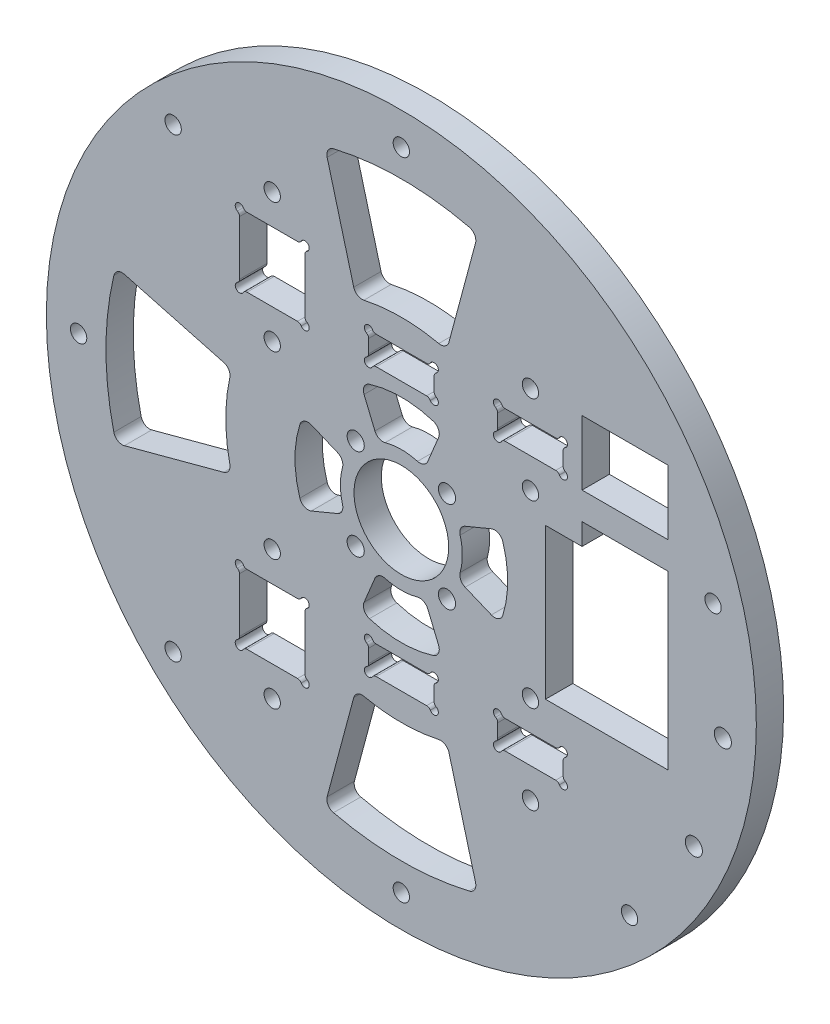
from build123d import *

# Parameters (mm, degrees)
SKETCH1_R                = 82.5
SKETCH1_R_2              = 1.89865
SKETCH1_R_3              = 1.9939
SKETCH1_R_4              = 11
BOSS_EXTRUDE1_DEPTH      = 6.35
SKETCH5_W                = 15.2
SKETCH5_H                = 16.075
CUT_EXTRUDE4_DEPTH       = 117.845293016
SKETCH6_R                = 1
CUT_EXTRUDE5_DEPTH       = 117.845293016
FILLET1_R                = 1
SKETCH10_W               = 53.521327686
SKETCH10_H               = 38.330479901
SKETCH10_W_2             = 53.671144578
SKETCH10_H_2             = 39.035756806
BOSS_EXTRUDE2_DEPTH      = 6.35
SKETCH11_W               = 15.2
SKETCH11_H               = 6.55
CUT_EXTRUDE8_DEPTH       = 117.845293016
SKETCH13_R               = 1
CUT_EXTRUDE9_DEPTH       = 117.845293016
FILLET2_R                = 1
LPATTERN3_COUNT          = 2
LPATTERN3_PITCH          = 30
FILLET2_OF_LPATTERN3_R   = 1
MIRROR3_DEPTH            = 6.35
SKETCH14_W               = 20
SKETCH14_H               = 15
CUT_EXTRUDE10_DEPTH      = 117.845293016
SKETCH15_R               = 1.89865
CUT_EXTRUDE12_DEPTH      = 117.845293016
CUT_EXTRUDE13_DEPTH      = 117.845293016
FILLET3_R                = 2
CIRPATTERN1_COUNT        = 4
FILLET3_OF_CIRPATTERN1_R = 2
CUT_EXTRUDE14_DEPTH      = 117.845293016
FILLET4_R                = 2
CIRPATTERN2_COUNT        = 4
FILLET4_OF_CIRPATTERN2_R = 2


# Read off the part's stored shape, not the designer's step: Mirror3
with BuildPart() as part:
    # Sketch1 → Boss-Extrude1 (new body)
    with BuildSketch(Plane.XY):
        Circle(SKETCH1_R)
        with Locations((72.444436972, 19.411428383)):
            Circle(SKETCH1_R_2, mode=Mode.SUBTRACT)
        with Locations((74.714602357, -6.536680706)):
            Circle(SKETCH1_R_3, mode=Mode.SUBTRACT)
        Circle(SKETCH1_R_4, mode=Mode.SUBTRACT)
        with Locations((67.973084028, -31.696369631)):
            Circle(SKETCH1_R_3, mode=Mode.SUBTRACT)
        with Locations((10.606601718, -10.606601718)):
            Circle(SKETCH1_R_3, mode=Mode.SUBTRACT)
        with Locations((0, -75)):
            Circle(SKETCH1_R_2, mode=Mode.SUBTRACT)
        with Locations((-10.606601718, -10.606601718)):
            Circle(SKETCH1_R_3, mode=Mode.SUBTRACT)
        with Locations((-10.606601718, 10.606601718)):
            Circle(SKETCH1_R_3, mode=Mode.SUBTRACT)
        with Locations((10.606601718, 10.606601718)):
            Circle(SKETCH1_R_3, mode=Mode.SUBTRACT)
        with Locations((-53.033008589, -53.033008589)):
            Circle(SKETCH1_R_2, mode=Mode.SUBTRACT)
        with Locations((-75, 0)):
            Circle(SKETCH1_R_2, mode=Mode.SUBTRACT)
        with Locations((-53.033008589, 53.033008589)):
            Circle(SKETCH1_R_2, mode=Mode.SUBTRACT)
        with Locations((0, 75)):
            Circle(SKETCH1_R_2, mode=Mode.SUBTRACT)
        with Locations((53.033008589, -53.033008589)):
            Circle(SKETCH1_R_2, mode=Mode.SUBTRACT)
    extrude(amount=BOSS_EXTRUDE1_DEPTH)

    # Sketch5 → Cut-Extrude4 (cut, through all)
    with BuildSketch(Plane.XY.offset(6.35)):
        with Locations((-30, -35.9375)):
            Rectangle(SKETCH5_W, SKETCH5_H)
        with Locations((-30, 35.9375)):
            Rectangle(SKETCH5_W, SKETCH5_H)
        with Locations((30, 35.9375)):
            Rectangle(SKETCH5_W, SKETCH5_H)
        with Locations((0, -35.9375)):
            Rectangle(SKETCH5_W, SKETCH5_H)
        with Locations((30, -35.9375)):
            Rectangle(SKETCH5_W, SKETCH5_H)
        with Locations((0, 35.9375)):
            Rectangle(SKETCH5_W, SKETCH5_H)
    extrude(amount=-CUT_EXTRUDE4_DEPTH, mode=Mode.SUBTRACT)

    # Sketch6 → Cut-Extrude5 (cut, through all)
    with BuildSketch(Plane.XY.offset(6.35)):
        with Locations((-37.6, 43.975)):
            Circle(SKETCH6_R)
        with Locations((-22.4, 43.975)):
            Circle(SKETCH6_R)
        with Locations((-37.6, 27.9)):
            Circle(SKETCH6_R)
        with Locations((-22.4, 27.9)):
            Circle(SKETCH6_R)
        with Locations((-7.6, 43.975)):
            Circle(SKETCH6_R)
        with Locations((7.6, 43.975)):
            Circle(SKETCH6_R)
        with Locations((-7.6, 27.9)):
            Circle(SKETCH6_R)
        with Locations((7.6, 27.9)):
            Circle(SKETCH6_R)
        with Locations((22.4, 43.975)):
            Circle(SKETCH6_R)
        with Locations((37.6, 43.975)):
            Circle(SKETCH6_R)
        with Locations((22.4, 27.9)):
            Circle(SKETCH6_R)
        with Locations((37.6, 27.9)):
            Circle(SKETCH6_R)
        with Locations((-37.6, -27.9)):
            Circle(SKETCH6_R)
        with Locations((-22.4, -27.9)):
            Circle(SKETCH6_R)
        with Locations((-37.6, -43.975)):
            Circle(SKETCH6_R)
        with Locations((-22.4, -43.975)):
            Circle(SKETCH6_R)
        with Locations((-7.6, -27.9)):
            Circle(SKETCH6_R)
        with Locations((7.6, -27.9)):
            Circle(SKETCH6_R)
        with Locations((-7.6, -43.975)):
            Circle(SKETCH6_R)
        with Locations((7.6, -43.975)):
            Circle(SKETCH6_R)
        with Locations((22.4, -27.9)):
            Circle(SKETCH6_R)
        with Locations((37.6, -27.9)):
            Circle(SKETCH6_R)
        with Locations((22.4, -43.975)):
            Circle(SKETCH6_R)
        with Locations((37.6, -43.975)):
            Circle(SKETCH6_R)
    extrude(amount=-CUT_EXTRUDE5_DEPTH, mode=Mode.SUBTRACT)

    # Fillet1
    fillet1_edges = [part.edges().sort_by_distance(p)[0] for p in [
        (-37.6, 42.975, 3.175),
        (-36.6, 43.975, 3.175),
        (-22.4, 42.975, 3.175),
        (-23.4, 43.975, 3.175),
        (-37.6, 28.9, 3.175),
        (-36.6, 27.9, 3.175),
        (-23.4, 27.9, 3.175),
        (-22.4, 28.9, 3.175),
        (-7.6, 42.975, 3.175),
        (-6.6, 43.975, 3.175),
        (7.6, 42.975, 3.175),
        (6.6, 43.975, 3.175),
        (-7.6, 28.9, 3.175),
        (-6.6, 27.9, 3.175),
        (6.6, 27.9, 3.175),
        (7.6, 28.9, 3.175),
        (22.4, 42.975, 3.175),
        (23.4, 43.975, 3.175),
        (37.6, 42.975, 3.175),
        (36.6, 43.975, 3.175),
        (22.4, 28.9, 3.175),
        (23.4, 27.9, 3.175),
        (36.6, 27.9, 3.175),
        (37.6, 28.9, 3.175),
        (-36.6, -27.9, 3.175),
        (-37.6, -28.9, 3.175),
        (-22.4, -28.9, 3.175),
        (-23.4, -27.9, 3.175),
        (-36.6, -43.975, 3.175),
        (-37.6, -42.975, 3.175),
        (-23.4, -43.975, 3.175),
        (-22.4, -42.975, 3.175),
        (-6.6, -27.9, 3.175),
        (-7.6, -28.9, 3.175),
        (7.6, -28.9, 3.175),
        (6.6, -27.9, 3.175),
        (-6.6, -43.975, 3.175),
        (-7.6, -42.975, 3.175),
        (6.6, -43.975, 3.175),
        (7.6, -42.975, 3.175),
        (23.4, -27.9, 3.175),
        (22.4, -28.9, 3.175),
        (37.6, -28.9, 3.175),
        (36.6, -27.9, 3.175),
        (23.4, -43.975, 3.175),
        (22.4, -42.975, 3.175),
        (36.6, -43.975, 3.175),
        (37.6, -42.975, 3.175),
    ]]
    fillet(fillet1_edges, radius=FILLET1_R)

    # Sketch10 → Boss-Extrude2 (add, through all)
    with BuildSketch(Plane(origin=(0, 0, 0), x_dir=(-1, 0, 0), z_dir=(0, 0, -1))):
        with Locations((-14.795735284, 41.600791801)):
            Rectangle(SKETCH10_W, SKETCH10_H)
        with Locations((-14.87064373, -42.15054159)):
            Rectangle(SKETCH10_W_2, SKETCH10_H_2)
    extrude(amount=-BOSS_EXTRUDE2_DEPTH)

    # Sketch11 → Cut-Extrude8 (cut, through all)
    with BuildSketch(Plane(origin=(0, 0, 0), x_dir=(-1, 0, 0), z_dir=(0, 0, -1))):
        with Locations((0, 31.175)):
            Rectangle(SKETCH11_W, SKETCH11_H)
    cut_extrude8 = extrude(amount=-CUT_EXTRUDE8_DEPTH, mode=Mode.SUBTRACT)

    # Sketch13 → Cut-Extrude9 (cut, through all)
    with BuildSketch(Plane(origin=(0, 0, 0), x_dir=(-1, 0, 0), z_dir=(0, 0, -1))):
        with Locations((-7.6, 34.45)):
            Circle(SKETCH13_R)
        with Locations((-7.6, 27.9)):
            Circle(SKETCH13_R)
        with Locations((7.6, 27.9)):
            Circle(SKETCH13_R)
        with Locations((7.6, 34.45)):
            Circle(SKETCH13_R)
    cut_extrude9 = extrude(amount=-CUT_EXTRUDE9_DEPTH, mode=Mode.SUBTRACT)

    # Fillet2
    fillet2_edges = [part.edges().sort_by_distance(p)[0] for p in [
        (6.6, 34.45, 3.175),
        (7.6, 33.45, 3.175),
        (-6.6, 34.45, 3.175),
        (7.6, 28.9, 3.175),
        (-6.6, 27.9, 3.175),
        (6.6, 27.9, 3.175),
        (-7.6, 28.9, 3.175),
        (-7.6, 33.45, 3.175),
    ]]
    fillet(fillet2_edges, radius=FILLET2_R)

    # LPattern3: Cut-Extrude8, Cut-Extrude9 ×2
    with Locations(*[(i * LPATTERN3_PITCH, 0, 0) for i in range(1, LPATTERN3_COUNT)]):
        add(cut_extrude8, mode=Mode.SUBTRACT)
        add(cut_extrude9, mode=Mode.SUBTRACT)

    # Fillet2 of LPattern3
    fillet2_of_lpattern3_edges = [part.edges().sort_by_distance(p)[0] for p in [
        (36.6, 34.45, 3.175),
        (37.6, 33.45, 3.175),
        (23.4, 34.45, 3.175),
        (37.6, 28.9, 3.175),
        (23.4, 27.9, 3.175),
        (36.6, 27.9, 3.175),
        (22.4, 28.9, 3.175),
        (22.4, 33.45, 3.175),
    ]]
    fillet(fillet2_of_lpattern3_edges, radius=FILLET2_OF_LPATTERN3_R)

    # Mirror3 outline → Mirror3 (cut)
    with BuildSketch(Plane.XY):
        with BuildLine():
            Line((-5.867949192, -34.45), (5.867949192, -34.45))
            ThreePointArc((5.867949192, -34.45), (6.367949192, -34.583974596), (6.733974596, -34.95))
            ThreePointArc((6.733974596, -34.95), (8.307106781, -35.157106781), (8.1, -33.583974596))
            ThreePointArc((8.1, -33.583974596), (7.733974596, -33.217949192), (7.6, -32.717949192))
            Line((7.6, -32.717949192), (7.6, -29.632050808))
            ThreePointArc((7.6, -29.632050808), (7.733974596, -29.132050808), (8.1, -28.766025404))
            ThreePointArc((8.1, -28.766025404), (8.307106781, -27.192893219), (6.733974596, -27.4))
            ThreePointArc((6.733974596, -27.4), (6.367949192, -27.766025404), (5.867949192, -27.9))
            Line((5.867949192, -27.9), (-5.867949192, -27.9))
            ThreePointArc((-5.867949192, -27.9), (-6.367949192, -27.766025404), (-6.733974596, -27.4))
            ThreePointArc((-6.733974596, -27.4), (-8.307106781, -27.192893219), (-8.1, -28.766025404))
            ThreePointArc((-8.1, -28.766025404), (-7.733974596, -29.132050808), (-7.6, -29.632050808))
            Line((-7.6, -29.632050808), (-7.6, -32.717949192))
            ThreePointArc((-7.6, -32.717949192), (-7.733974596, -33.217949192), (-8.1, -33.583974596))
            ThreePointArc((-8.1, -33.583974596), (-8.307106781, -35.157106781), (-6.733974596, -34.95))
            ThreePointArc((-6.733974596, -34.95), (-6.367949192, -34.583974596), (-5.867949192, -34.45))
        make_face()
        with BuildLine():
            Line((24.132050808, -34.45), (35.867949192, -34.45))
            ThreePointArc((35.867949192, -34.45), (36.367949192, -34.583974596), (36.733974596, -34.95))
            ThreePointArc((36.733974596, -34.95), (38.307106781, -35.157106781), (38.1, -33.583974596))
            ThreePointArc((38.1, -33.583974596), (37.733974596, -33.217949192), (37.6, -32.717949192))
            Line((37.6, -32.717949192), (37.6, -29.632050808))
            ThreePointArc((37.6, -29.632050808), (37.733974596, -29.132050808), (38.1, -28.766025404))
            ThreePointArc((38.1, -28.766025404), (38.307106781, -27.192893219), (36.733974596, -27.4))
            ThreePointArc((36.733974596, -27.4), (36.367949192, -27.766025404), (35.867949192, -27.9))
            Line((35.867949192, -27.9), (24.132050808, -27.9))
            ThreePointArc((24.132050808, -27.9), (23.632050808, -27.766025404), (23.266025404, -27.4))
            ThreePointArc((23.266025404, -27.4), (21.692893219, -27.192893219), (21.9, -28.766025404))
            ThreePointArc((21.9, -28.766025404), (22.266025404, -29.132050808), (22.4, -29.632050808))
            Line((22.4, -29.632050808), (22.4, -32.717949192))
            ThreePointArc((22.4, -32.717949192), (22.266025404, -33.217949192), (21.9, -33.583974596))
            ThreePointArc((21.9, -33.583974596), (21.692893219, -35.157106781), (23.266025404, -34.95))
            ThreePointArc((23.266025404, -34.95), (23.632050808, -34.583974596), (24.132050808, -34.45))
        make_face()
    extrude(amount=MIRROR3_DEPTH, mode=Mode.SUBTRACT)

    # Sketch14 → Cut-Extrude10 (cut, through all)
    with BuildSketch(Plane.XY):
        Polygon((42, 20.65), (62, 20.65), (62, -19.35), (33.5, -19.35), (33.5, 15.65), (42, 15.65), align=None)
        with Locations((52, 34.5)):
            Rectangle(SKETCH14_W, SKETCH14_H)
    extrude(amount=CUT_EXTRUDE10_DEPTH, mode=Mode.SUBTRACT)

    # Sketch15 → Cut-Extrude12 (cut, through all)
    with BuildSketch(Plane.XY.offset(6.35)):
        with Locations((-30, 50.975)):
            Circle(SKETCH15_R)
        with Locations((-30, 20.9)):
            Circle(SKETCH15_R)
        with Locations((30, 41.45)):
            Circle(SKETCH15_R)
        with Locations((30, 20.9)):
            Circle(SKETCH15_R)
    cut_extrude12 = extrude(amount=-CUT_EXTRUDE12_DEPTH, mode=Mode.SUBTRACT)

    # Mirror4: Cut-Extrude12 across plane
    add(cut_extrude12.mirror(Plane.ZX), mode=Mode.SUBTRACT)

    # Sketch16 → Cut-Extrude13 (cut, through all)
    with BuildSketch(Plane.XY.offset(6.35)):
        with BuildLine():
            Line((-9.461847865, -22.842921441), (-5.424537654, -13.095992373))
            ThreePointArc((-5.424537654, -13.095992373), (0, -14.175), (5.424537654, -13.095992373))
            Line((5.424537654, -13.095992373), (9.461847865, -22.842921441))
            ThreePointArc((9.461847865, -22.842921441), (0, -24.725), (-9.461847865, -22.842921441))
        make_face()
    cut_extrude13 = extrude(amount=-CUT_EXTRUDE13_DEPTH, mode=Mode.SUBTRACT)

    # Fillet3
    fillet3_edges = [part.edges().sort_by_distance(p)[0] for p in [
        (-5.424537654, -13.095992373, 3.175),
        (5.424537654, -13.095992373, 3.175),
        (9.461847865, -22.842921441, 3.175),
        (-9.461847865, -22.842921441, 3.175),
    ]]
    fillet(fillet3_edges, radius=FILLET3_R)

    # CirPattern1: Cut-Extrude13 ×4 about axis
    cirpattern1_axis = Axis((0, 0, 0), (0, 0, 1))
    for i in range(1, CIRPATTERN1_COUNT):
        add(cut_extrude13.rotate(cirpattern1_axis, i * 360 / CIRPATTERN1_COUNT), mode=Mode.SUBTRACT)

    # Fillet3 of CirPattern1
    fillet3_of_cirpattern1_edges = [part.edges().sort_by_distance(p)[0] for p in [
        (13.095992373, -5.424537654, 3.175),
        (13.095992373, 5.424537654, 3.175),
        (22.842921441, 9.461847865, 3.175),
        (22.842921441, -9.461847865, 3.175),
        (5.424537654, 13.095992373, 3.175),
        (-5.424537654, 13.095992373, 3.175),
        (-9.461847865, 22.842921441, 3.175),
        (9.461847865, 22.842921441, 3.175),
        (-13.095992373, 5.424537654, 3.175),
        (-13.095992373, -5.424537654, 3.175),
        (-22.842921441, -9.461847865, 3.175),
        (-22.842921441, 9.461847865, 3.175),
    ]]
    fillet(fillet3_of_cirpattern1_edges, radius=FILLET3_OF_CIRPATTERN1_R)

    # Sketch17 → Cut-Extrude14 (cut, through all)
    with BuildSketch(Plane.XY.offset(6.35)):
        with BuildLine():
            Line((-17.767927446, -66.310807975), (-10.55981704, -39.409773713))
            ThreePointArc((-10.55981704, -39.409773713), (0, -40.8), (10.55981704, -39.409773713))
            Line((10.55981704, -39.409773713), (17.767927446, -66.310807975))
            ThreePointArc((17.767927446, -66.310807975), (0, -68.65), (-17.767927446, -66.310807975))
        make_face()
    cut_extrude14 = extrude(amount=-CUT_EXTRUDE14_DEPTH, mode=Mode.SUBTRACT)

    # Fillet4
    fillet4_edges = [part.edges().sort_by_distance(p)[0] for p in [
        (-10.55981704, -39.409773713, 3.175),
        (10.55981704, -39.409773713, 3.175),
        (17.767927446, -66.310807975, 3.175),
        (-17.767927446, -66.310807975, 3.175),
    ]]
    fillet(fillet4_edges, radius=FILLET4_R)

    # CirPattern2: Cut-Extrude14 ×4 about axis, 1 skipped
    cirpattern2_axis = Axis((0, 0, 0), (0, 0, -1))
    add([cut_extrude14.rotate(cirpattern2_axis, i * 360 / CIRPATTERN2_COUNT) for i in range(1, CIRPATTERN2_COUNT) if i not in (3,)], mode=Mode.SUBTRACT)

    # Fillet4 of CirPattern2
    fillet4_of_cirpattern2_edges = [part.edges().sort_by_distance(p)[0] for p in [
        (-39.409773713, 10.55981704, 3.175),
        (-39.409773713, -10.55981704, 3.175),
        (-66.310807975, -17.767927446, 3.175),
        (-66.310807975, 17.767927446, 3.175),
        (10.55981704, 39.409773713, 3.175),
        (-10.55981704, 39.409773713, 3.175),
        (-17.767927446, 66.310807975, 3.175),
        (17.767927446, 66.310807975, 3.175),
    ]]
    fillet(fillet4_of_cirpattern2_edges, radius=FILLET4_OF_CIRPATTERN2_R)


solid = part.part
